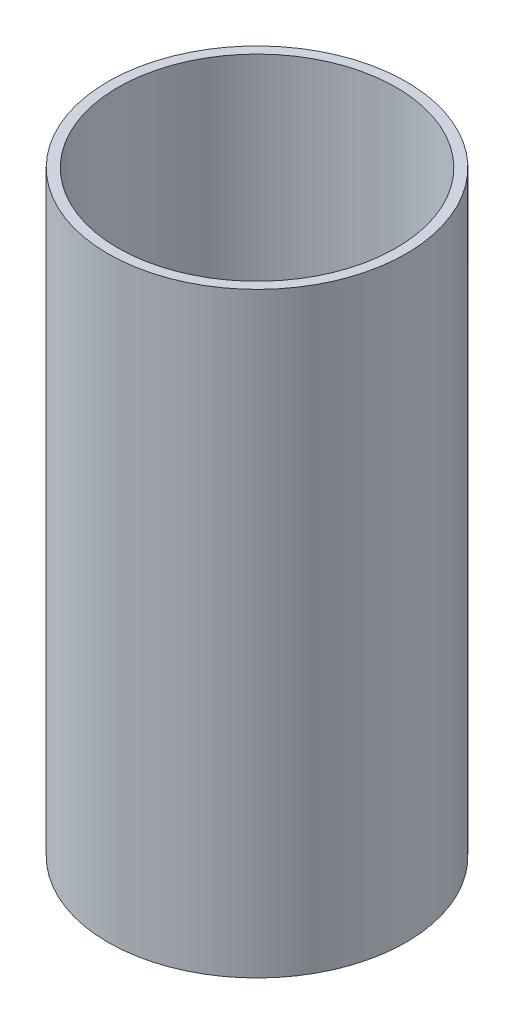
from build123d import *

# Parameters (mm, degrees)
ESQUISSE1_R        = 75
ESQUISSE1_R_2      = 70
BOSS_EXTRU_1_DEPTH = 300


with BuildPart() as part:
    # Esquisse1 → Boss.-Extru.1 (new body)
    with BuildSketch(Plane(origin=(0, 0, 0), x_dir=(1, 0, 0), z_dir=(0, 1, 0))):
        Circle(ESQUISSE1_R)
        Circle(ESQUISSE1_R_2, mode=Mode.SUBTRACT)
    extrude(amount=BOSS_EXTRU_1_DEPTH)


solid = part.part
